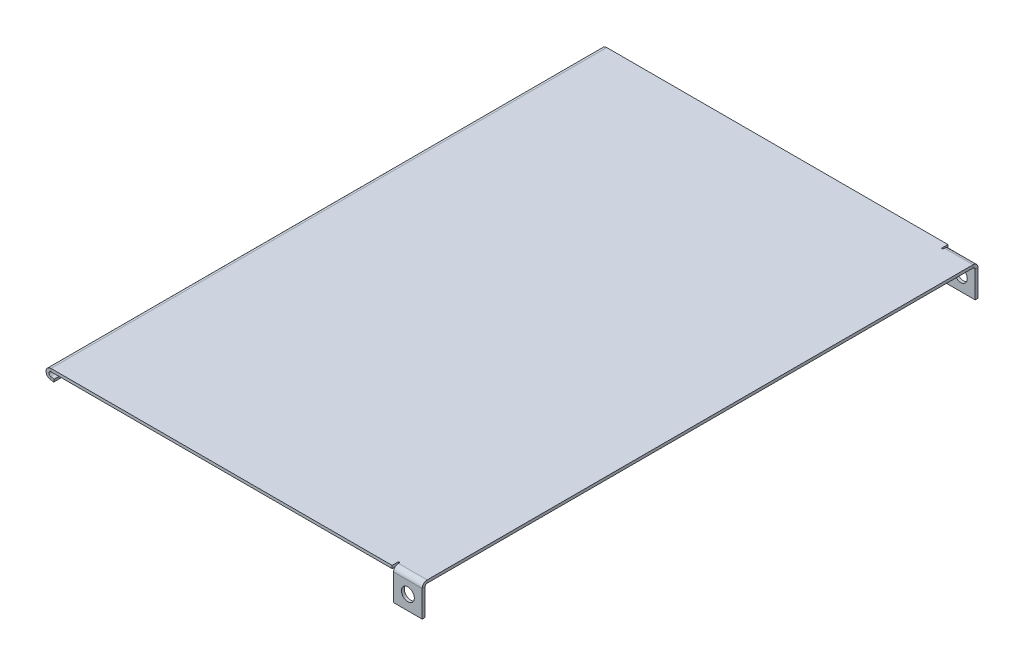
from build123d import *

# Parameters (mm, degrees)
SKETCH1_W                     = 130
SKETCH1_H                     = 194
BASE_FLANGE1_DEPTH            = 1
EDGE_FLANGE1_STRIP_CUT_DEPTH  = 194
EDGE_FLANGE1_DEPTH            = 194
EDGE_FLANGE2_STRIP_W          = 5.4732
EDGE_FLANGE2_STRIP_H          = 1
EDGE_FLANGE2_STRIP_CUT_DEPTH  = 10
EDGE_FLANGE2_RELIEF_W         = 5.9732
EDGE_FLANGE2_RELIEF_H         = 0.5
EDGE_FLANGE2_RELIEF_CUT_DEPTH = 1
EDGE_FLANGE2_DEPTH            = 10
SKETCH14_R                    = 2.25
CUT_EXTRUDE1_DEPTH            = 206.316765339


# Sheet-metal steps are written as plain solids
with BuildPart() as part:
    # Sketch1 → Base-Flange1 (new body)
    with BuildSketch(Plane(origin=(0, 0, 0), x_dir=(1, 0, 0), z_dir=(0, 1, 0))):
        Rectangle(SKETCH1_W, SKETCH1_H)
    extrude(amount=-BASE_FLANGE1_DEPTH)

    # Edge-Flange1 strip (across the edge) → Edge-Flange1 strip cut (cut)
    with BuildSketch(Plane(origin=(-73, -1, 97), x_dir=(0.17364817766693103, 0.984807753012208, 0), z_dir=(0, 0, -1))):
        Polygon((-9.805618071, -61.369193981), (2.446817144, 8.117819101), (1.462009391, 8.291467279), (-10.790425824, -61.195545803), align=None)
    extrude(amount=EDGE_FLANGE1_STRIP_CUT_DEPTH, mode=Mode.SUBTRACT)

    # Edge-Flange1 section (across the edge) → Edge-Flange1 (add)
    with BuildSketch(Plane(origin=(-73, -1, 97), x_dir=(0.17364817766693103, 0.984807753012208, 0), z_dir=(0, 0, -1))):
        with BuildLine():
            Line((-1, 8.419376526), (-1, 9.682776526))
            Line((-1, 9.682776526), (0, 9.682776526))
            Line((0, 9.682776526), (0, 8.419376526))
            ThreePointArc((0, 8.419376526), (0.67240108, 7.685579512), (1.462009391, 8.291467279))
            Line((1.462009391, 8.291467279), (2.446817144, 8.117819101))
            ThreePointArc((2.446817144, 8.117819101), (0.585245337, 6.689384814), (-1, 8.419376526))
        make_face()
    extrude(amount=EDGE_FLANGE1_DEPTH)

    # Edge-Flange2 strip (across the edge) → Edge-Flange2 strip cut (cut)
    with BuildSketch(Plane(origin=(55, -1, -97), x_dir=(0, 0, 1), z_dir=(1, 0, 0))):
        with Locations((-1, -0.5)):
            Rectangle(EDGE_FLANGE2_STRIP_W, EDGE_FLANGE2_STRIP_H)
    edge_flange2_strip_cut = extrude(amount=EDGE_FLANGE2_STRIP_CUT_DEPTH, mode=Mode.SUBTRACT)

    # Edge-Flange2 relief (on the sheet) → Edge-Flange2 relief cut (cut)
    with BuildSketch(Plane(origin=(55, -1, -95.2634), x_dir=(0, 0, 1), z_dir=(0, -1, 0))):
        with Locations((-2.4866, 0.25)):
            Rectangle(EDGE_FLANGE2_RELIEF_W, EDGE_FLANGE2_RELIEF_H)
    edge_flange2_relief_cut = extrude(amount=-EDGE_FLANGE2_RELIEF_CUT_DEPTH, mode=Mode.SUBTRACT)

    # Edge-Flange2 section (across the edge) → Edge-Flange2 (add)
    with BuildSketch(Plane(origin=(55, -1, -97), x_dir=(0, 0, 1), z_dir=(1, 0, 0))):
        with BuildLine():
            Line((0, 0.7366), (0, 10))
            Line((0, 10), (1, 10))
            Line((1, 10), (1, 0.7366))
            ThreePointArc((1, 0.7366), (1.215745145, 0.215745145), (1.7366, 0))
            Line((1.7366, 0), (1.7366, -1))
            ThreePointArc((1.7366, -1), (0.508638364, -0.491361636), (0, 0.7366))
        make_face()
    edge_flange2 = extrude(amount=EDGE_FLANGE2_DEPTH)

    # Sketch14 → Cut-Extrude1 (cut, through all)
    with BuildSketch(Plane(origin=(0, 0, -97), x_dir=(-1, 0, 0), z_dir=(0, 0, -1))):
        with Locations(Location((-60, -6, 0), (0, 0, 90))):
            Circle(SKETCH14_R)
    cut_extrude1 = extrude(amount=-CUT_EXTRUDE1_DEPTH, mode=Mode.SUBTRACT)

    # Mirror1: Edge-Flange2 strip cut, Edge-Flange2 relief cut, Edge-Flange2, Cut-Extrude1 across plane
    add(edge_flange2_strip_cut.mirror(Plane.XY), mode=Mode.SUBTRACT)
    add(edge_flange2_relief_cut.mirror(Plane.XY), mode=Mode.SUBTRACT)
    add(edge_flange2.mirror(Plane.XY))
    add(cut_extrude1.mirror(Plane.XY), mode=Mode.SUBTRACT)


solid = part.part
